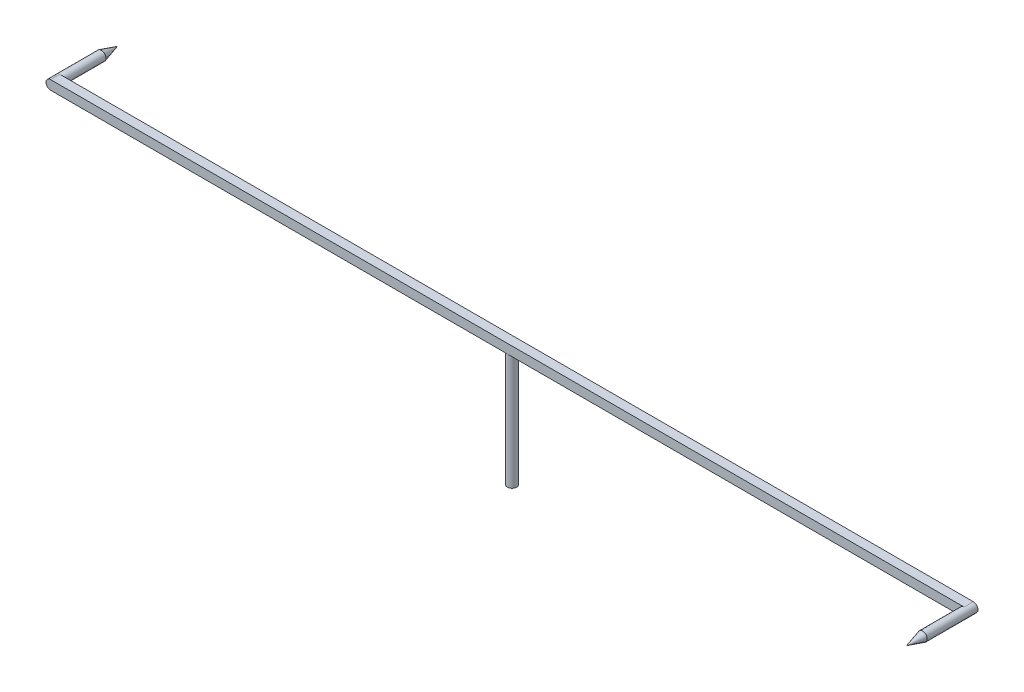
from build123d import *

# Parameters (mm, degrees)
SKETCH_1_R      = 0.4
EXTRUDE_1_DEPTH = 10
SKETCH_2_W      = 80
SKETCH_2_H      = 0.8
EXTRUDE_2_DEPTH = 0.8
FILLET_1_R      = 0.4
SKETCH_3_R      = 0.4
EXTRUDE_3_DEPTH = 3.6
SKETCH_4_R      = 0.4
EXTRUDE_4_DEPTH = 3.6


with BuildPart() as part:
    # 草图1 → 凸台-拉伸1 (new body)
    with BuildSketch(Plane(origin=(0, 0, 0), x_dir=(1, 0, 0), z_dir=(0, 1, 0))):
        with Locations(Location((0, 0, 0), (0, 0, 270))):
            Circle(SKETCH_1_R)
    extrude(amount=EXTRUDE_1_DEPTH)

    # 草图2 → 凸台-拉伸2 (add)
    with BuildSketch(Plane(origin=(0, 10, 0), x_dir=(1, 0, 0), z_dir=(0, 1, 0))):
        Rectangle(SKETCH_2_W, SKETCH_2_H)
    extrude(amount=EXTRUDE_2_DEPTH)

    # 圆角1
    fillet_1_edges = [part.edges().sort_by_distance(p)[0] for p in [
        (40, 10, 0),
        (40, 10.8, 0),
        (-40, 10, 0),
        (-40, 10.8, 0),
    ]]
    fillet(fillet_1_edges, radius=FILLET_1_R - 0.0001)  # a hair under: the kernel refuses the full size

    # 草图3 → 凸台-拉伸3 (add)
    with BuildSketch(Plane.XY.offset(0.4)):
        with Locations((39.6, 10.4)):
            Circle(SKETCH_3_R)
    extrude(amount=EXTRUDE_3_DEPTH)

    # 草图4 → 凸台-拉伸4 (add)
    with BuildSketch(Plane(origin=(0, 0, -0.4), x_dir=(-1, 0, 0), z_dir=(0, 0, -1))):
        with Locations((39.6, 10.4)):
            Circle(SKETCH_4_R)
    extrude(amount=EXTRUDE_4_DEPTH)

    # 草图5 → 旋转1 (revolve)
    with BuildSketch(Plane(origin=(0, 10.4, 0), x_dir=(1, 0, 0), z_dir=(0, 1, 0))):
        Polygon((39.6, -4), (39.6, -5.4), (40, -4), align=None)
    revolve(axis=Axis((39.6, 10.4, 4), (0, 0, 1)))

    # 草图6 → 旋转2 (revolve)
    with BuildSketch(Plane(origin=(0, 10.4, 0), x_dir=(1, 0, 0), z_dir=(0, 1, 0))):
        Polygon((-39.6, 4), (-39.6, 5.4), (-40, 4), align=None)
    revolve(axis=Axis((-39.6, 10.4, -4), (0, 0, -1)))


solid = part.part
